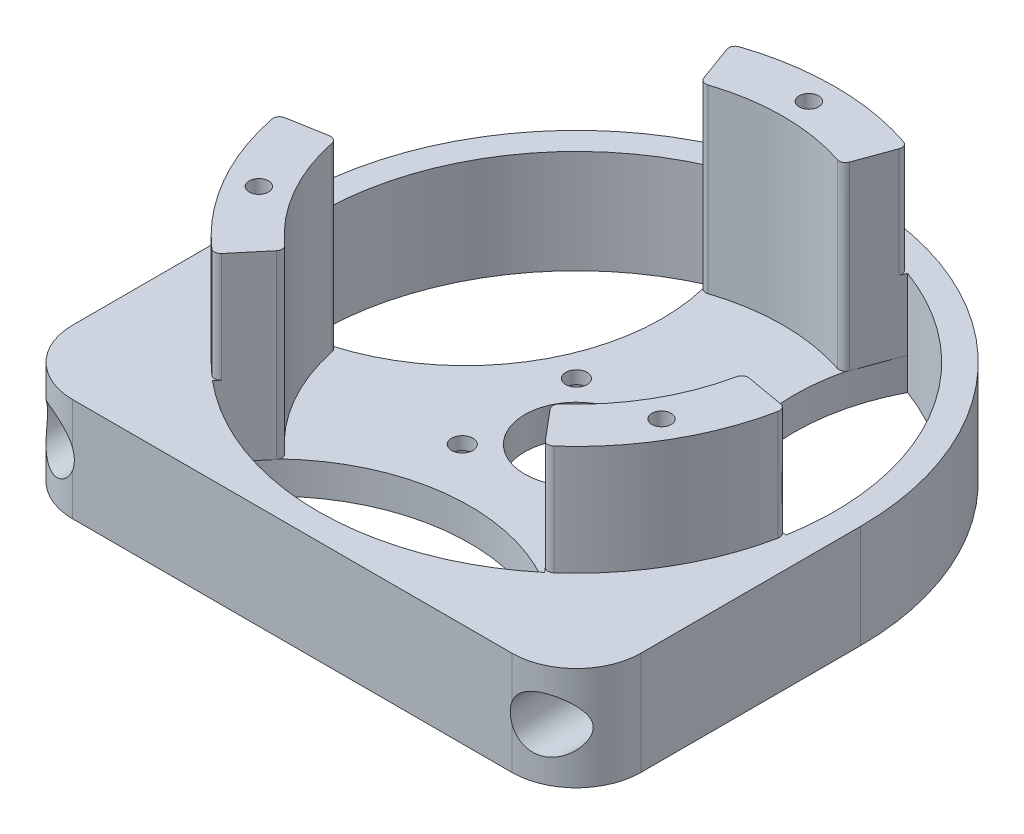
from build123d import *

# Parameters (mm, degrees)
BOSS_EXTRUDE1_DEPTH = 16
SKETCH2_R           = 4.25
CUT_EXTRUDE1_DEPTH  = 20
FILLET1_R           = 10
SKETCH3_R           = 40
CUT_EXTRUDE2_DEPTH  = 65.249513779
SKETCH5_R           = 40.5
SKETCH5_R_2         = 8
BOSS_EXTRUDE2_DEPTH = 5
BOSS_EXTRUDE3_START = 28
BOSS_EXTRUDE3_DEPTH = 28
SKETCH7_R           = 1.5
CUT_EXTRUDE3_DEPTH  = 71.434366784
CIRPATTERN1_COUNT   = 3
SKETCH8_R           = 1.65
CUT_EXTRUDE4_DEPTH  = 69.234888566
SKETCH9_R           = 3.5
CUT_EXTRUDE5_DEPTH  = 3
FILLET2_R           = 0.5
CUT_EXTRUDE6_DEPTH  = 69.234888566
CIRPATTERN2_COUNT   = 3
FILLET4_R           = 1


with BuildPart() as part:
    # Sketch1 → Boss-Extrude1 (new body)
    with BuildSketch(Plane(origin=(0, 0, 0), x_dir=(1, 0, 0), z_dir=(0, 1, 0))):
        with BuildLine():
            Line((-44, 0), (-44, -44))
            Line((-44, -44), (44, -44))
            Line((44, -44), (44, 0))
            ThreePointArc((44, 0), (0, 44), (-44, 0))
        make_face()
    extrude(amount=BOSS_EXTRUDE1_DEPTH)

    # Sketch2 → Cut-Extrude1 (cut)
    with BuildSketch(Plane.XY.offset(44)):
        with Locations((-38, 8)):
            Circle(SKETCH2_R)
        with Locations(Location((38, 8, 0), (0, 0, 180))):
            Circle(SKETCH2_R)
    extrude(amount=-CUT_EXTRUDE1_DEPTH, mode=Mode.SUBTRACT)

    # Fillet1
    # the kernel refuses this fillet: 10 mm, written as the material it takes off along each edge
    with BuildSketch(Plane(origin=(44, -25, 44), x_dir=(-1, 0, 0), z_dir=(0, 1, 0)), Plane(origin=(-44, -25, 44), x_dir=(0, 0, -1), z_dir=(0, 1, 0))) as fillet1_piece_1:
        with BuildLine():
            CenterArc((FILLET1_R, -FILLET1_R), FILLET1_R, 90, 90)
            Line((0, -FILLET1_R), (0, 0))
            Line((0, 0), (FILLET1_R, 0))
        make_face()
    extrude(amount=66, mode=Mode.SUBTRACT)

    # Sketch3 → Cut-Extrude2 (cut, through all)
    with BuildSketch(Plane(origin=(0, 16, 0), x_dir=(1, 0, 0), z_dir=(0, 1, 0))):
        with Locations(Location((0, 0, 0), (0, 0, 270))):
            Circle(SKETCH3_R)
    extrude(amount=-CUT_EXTRUDE2_DEPTH, mode=Mode.SUBTRACT)

    # Sketch5 → Boss-Extrude2 (add)
    with BuildSketch(Plane(origin=(0, 0, 0), x_dir=(1, 0, 0), z_dir=(0, 1, 0))):
        Circle(SKETCH5_R)
        with Locations(Location((0, 0, 0), (0, 0, 270))):
            Circle(SKETCH5_R_2, mode=Mode.SUBTRACT)
    extrude(amount=BOSS_EXTRUDE2_DEPTH)

    # Sketch6 → Boss-Extrude3 (add)
    with BuildSketch(Plane(origin=(0, 5, 0), x_dir=(1, 0, 0), z_dir=(0, 1, 0)).offset(BOSS_EXTRUDE3_START)):
        with BuildLine():
            Line((-13.680805733, 37.587704831), (-10.944644586, 30.070163865))
            ThreePointArc((-10.944644586, 30.070163865), (0, 32), (10.944644586, 30.070163865))
            Line((10.944644586, 30.070163865), (13.680805733, 37.587704831))
            ThreePointArc((13.680805733, 37.587704831), (0, 40), (-13.680805733, 37.587704831))
        make_face()
    boss_extrude3 = extrude(amount=-BOSS_EXTRUDE3_DEPTH)

    # Sketch7 → Cut-Extrude3 (cut, through all)
    with BuildSketch(Plane(origin=(0, 33, 0), x_dir=(1, 0, 0), z_dir=(0, 1, 0))):
        with Locations(Location((0, 36, 0), (0, 0, 270))):
            Circle(SKETCH7_R)
    cut_extrude3 = extrude(amount=-CUT_EXTRUDE3_DEPTH, mode=Mode.SUBTRACT)

    # CirPattern1: Boss-Extrude3, Cut-Extrude3 ×3 about axis
    cirpattern1_axis = Axis((0, 0, 0), (0, 1, 0))
    add([boss_extrude3.rotate(cirpattern1_axis, i * 360 / CIRPATTERN1_COUNT) for i in range(1, CIRPATTERN1_COUNT)])
    add([cut_extrude3.rotate(cirpattern1_axis, i * 360 / CIRPATTERN1_COUNT) for i in range(1, CIRPATTERN1_COUNT)], mode=Mode.SUBTRACT)

    # Sketch8 → Cut-Extrude4 (cut, through all)
    with BuildSketch(Plane(origin=(0, 5, 0), x_dir=(1, 0, 0), z_dir=(0, 1, 0))):
        with Locations(Location((-8.838834765, 8.838834765, 0), (0, 0, 270))):
            Circle(SKETCH8_R)
        with Locations(Location((8.838834765, 8.838834765, 0), (0, 0, 270))):
            Circle(SKETCH8_R)
        with Locations(Location((8.838834765, -8.838834765, 0), (0, 0, 270))):
            Circle(SKETCH8_R)
        with Locations(Location((-8.838834765, -8.838834765, 0), (0, 0, 270))):
            Circle(SKETCH8_R)
    extrude(amount=-CUT_EXTRUDE4_DEPTH, mode=Mode.SUBTRACT)

    # Sketch9 → Cut-Extrude5 (cut)
    with BuildSketch(Plane.XZ):
        with Locations(Location((8.838834765, 8.838834765, 0), (0, 0, 270))):
            Circle(SKETCH9_R)
        with Locations(Location((-8.838834765, 8.838834765, 0), (0, 0, 270))):
            Circle(SKETCH9_R)
        with Locations(Location((8.838834765, -8.838834765, 0), (0, 0, 270))):
            Circle(SKETCH9_R)
        with Locations(Location((-8.838834765, -8.838834765, 0), (0, 0, 270))):
            Circle(SKETCH9_R)
    extrude(amount=-CUT_EXTRUDE5_DEPTH, mode=Mode.SUBTRACT)

    # Fillet2
    fillet2_edges = [part.edges().sort_by_distance(p)[0] for p in [
        (-8.838834765, 0, 12.338834765),
        (8.838834765, 0, -5.338834765),
        (-8.838834765, 0, -5.338834765),
        (8.838834765, 0, 12.338834765),
    ]]
    fillet(fillet2_edges, radius=FILLET2_R)

    # Sketch10 → Cut-Extrude6 (cut, through all)
    with BuildSketch(Plane(origin=(0, 5, 0), x_dir=(1, 0, 0), z_dir=(0, 1, 0))):
        with BuildLine():
            ThreePointArc((13.680805733, 37.587704831), (14.309677586, 8.261696207), (39.39231012, -6.945927107))
            ThreePointArc((39.39231012, -6.945927107), (34.641016151, 20), (13.680805733, 37.587704831))
        make_face()
    cut_extrude6 = extrude(amount=-CUT_EXTRUDE6_DEPTH, mode=Mode.SUBTRACT)

    # CirPattern2: Cut-Extrude6 ×3 about axis
    cirpattern2_axis = Axis((0, 0, 0), (0, 1, 0))
    for i in range(1, CIRPATTERN2_COUNT):
        add(cut_extrude6.rotate(cirpattern2_axis, i * 360 / CIRPATTERN2_COUNT), mode=Mode.SUBTRACT)

    # Fillet4
    # the kernel refuses this fillet: 1 mm, written as the material it takes off along each edge
    with BuildSketch(Plane(origin=(13.680805733, 35.56431335, -37.587704831), x_dir=(-0.3420201433256679, 0, 0.9396926207859085), z_dir=(0, -1, 0)), Plane(origin=(-39.39231012, 35.56431335, 6.945927107), x_dir=(0.9848077530122079, 0, -0.17364817766693066), z_dir=(0, -1, 0))) as fillet4_piece_1:
        with BuildLine():
            CenterArc((1.012822621, 1), FILLET4_R, 178.530716419, 91.469283581)
            ThreePointArc((0.013151406, 1.025641026), (0.003287987, 0.51286267), (0, 0))
            Line((0, 0), (1.012822621, 0))
        make_face()
    extrude(amount=19.56431335, mode=Mode.SUBTRACT)
    with BuildSketch(Plane(origin=(-13.680805733, 35.56431335, -37.587704831), x_dir=(0.3420201433256646, 0, 0.93969262078591), z_dir=(0, -1, 0)), Plane(origin=(39.39231012, 35.56431335, 6.945927107), x_dir=(-0.984807753012207, 0, -0.17364817766693638), z_dir=(0, -1, 0))) as fillet4_piece_2:
        with BuildLine():
            CenterArc((1.012822621, -1), FILLET4_R, 90, 91.469283581)
            ThreePointArc((0.013151406, -1.025641026), (0.003287987, -0.51286267), (0, 0))
            Line((0, 0), (1.012822621, 0))
        make_face()
    extrude(amount=19.56431335, mode=Mode.SUBTRACT)
    with BuildSketch(Plane(origin=(-10.944644586, 35.462112512, -30.070163865), x_dir=(-0.34202014332566283, 0, -0.9396926207859105), z_dir=(0, -1, 0)), Plane(origin=(-20.56920351, 35.462112512, 24.51342218), x_dir=(-0.6427876096865429, 0, 0.766044443118975), z_dir=(0, -1, 0)), Plane(origin=(31.513848096, 35.462112512, 5.556741685), x_dir=(0.984807753012207, 0, 0.1736481776669362), z_dir=(0, -1, 0))) as fillet4_piece_3:
        with BuildLine():
            CenterArc((0.984845005, 1), FILLET4_R, 181.736501576, 88.263498424)
            ThreePointArc((-0.014695753, 0.96969697), (-0.003674149, 0.48490416), (0, 0))
            Line((0, 0), (0.984845005, 0))
        make_face()
    extrude(amount=30.462112512, mode=Mode.SUBTRACT)
    with BuildSketch(Plane(origin=(10.944644586, 35.462112512, -30.070163865), x_dir=(0.34202014332566955, 0, -0.9396926207859082), z_dir=(0, -1, 0)), Plane(origin=(-31.513848096, 35.462112512, 5.556741685), x_dir=(-0.9848077530122084, 0, 0.17364817766692914), z_dir=(0, -1, 0)), Plane(origin=(20.56920351, 35.462112512, 24.51342218), x_dir=(0.6427876096865386, 0, 0.7660444431189787), z_dir=(0, -1, 0))) as fillet4_piece_4:
        with BuildLine():
            CenterArc((0.984845005, -1), FILLET4_R, 90, 88.263498424)
            ThreePointArc((-0.014695753, -0.96969697), (-0.003674149, -0.48490416), (0, 0))
            Line((0, 0), (0.984845005, 0))
        make_face()
    extrude(amount=30.462112512, mode=Mode.SUBTRACT)
    with BuildSketch(Plane(origin=(-25.711504387, 35.56431335, 30.641777725), x_dir=(-0.7577399302790805, 0, -0.6525566627202992), z_dir=(0, -1, 0))) as fillet4_piece_5:
        with BuildLine():
            CenterArc((1.012903773, 0.9999178), FILLET4_R, 179.265358209, 91.469283581)
            Line((0.012985973, 1.012739367), (0, 0))
            ThreePointArc((0, 0), (0.51286267, -0.003287987), (1.02572534, 0))
        make_face()
    extrude(amount=19.56431335, mode=Mode.SUBTRACT)
    with BuildSketch(Plane(origin=(25.711504387, 35.56431335, 30.641777725), x_dir=(0.7577399302790873, 0, -0.6525566627202912), z_dir=(0, -1, 0))) as fillet4_piece_6:
        with BuildLine():
            CenterArc((1.012903773, -0.9999178), FILLET4_R, 89.265358209, 91.469283581)
            Line((0.012985973, -1.012739367), (0, 0))
            ThreePointArc((0, 0), (0.51286267, 0.003287987), (1.02572534, 0))
        make_face()
    extrude(amount=19.56431335, mode=Mode.SUBTRACT)


solid = part.part
